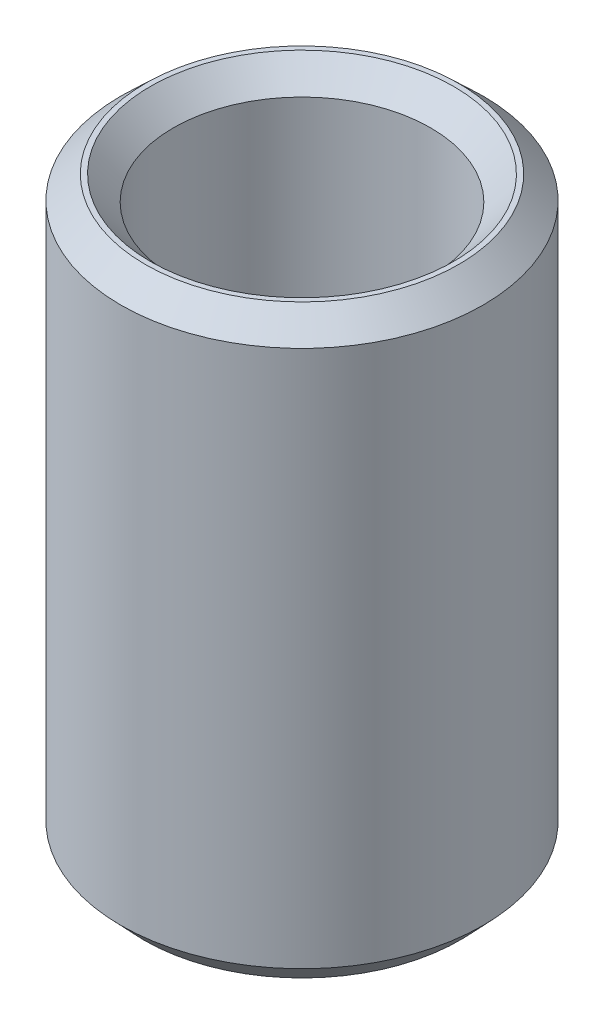
from build123d import *
from OCP.BRepFilletAPI import BRepFilletAPI_MakeChamfer

# Parameters (mm, degrees)
SKETCH1_R           = 15
BOSS_EXTRUDE1_DEPTH = 48.421484013
SKETCH2_R           = 10.652734929
CUT_EXTRUDE1_DEPTH  = 53.864355799
CHAMFER1_SIZE       = 1.909002523
CHAMFER1_SIZE2      = 2.013737742


with BuildPart() as part:
    # Sketch1 → Boss-Extrude1 (new body)
    with BuildSketch(Plane(origin=(0, 0, 0), x_dir=(1, 0, 0), z_dir=(0, 1, 0))):
        Circle(SKETCH1_R)
    extrude(amount=BOSS_EXTRUDE1_DEPTH)

    # Sketch2 → Cut-Extrude1 (cut, through all)
    with BuildSketch(Plane(origin=(0, 0, 0), x_dir=(1, 0, 0), z_dir=(0, 1, 0))):
        Circle(SKETCH2_R)
    extrude(amount=CUT_EXTRUDE1_DEPTH, mode=Mode.SUBTRACT)

    # Chamfer1: one chamfer whose edges measure the first distance from different faces: ONE call of the kernel's chamfer builder (chamfer() names one face for all edges)
    chamfer1_edges_1 = [part.edges().sort_by_distance(p)[0] for p in [
        (-10.652734929, 48.421484013, 0),
    ]]
    chamfer1_side_1 = [part.faces().sort_by_distance(p)[0] for p in [
        (-14.575735931, 48.421484013, 0),
    ]]
    chamfer1_edges_2 = [part.edges().sort_by_distance(p)[0] for p in [
        (-10.652734929, 0, 0),
    ]]
    chamfer1_side_2 = [part.faces().sort_by_distance(p)[0] for p in [
        (-10.652734929, 24.210742007, 0),
    ]]
    chamfer1_edges_3 = [part.edges().sort_by_distance(p)[0] for p in [
        (-15, 0, 0),
    ]]
    chamfer1_side_3 = [part.faces().sort_by_distance(p)[0] for p in [
        (-14.575735931, 0, 0),
    ]]
    chamfer1_edges_4 = [part.edges().sort_by_distance(p)[0] for p in [
        (-15, 48.421484013, 0),
    ]]
    chamfer1_side_4 = [part.faces().sort_by_distance(p)[0] for p in [
        (-15, 24.210742007, 0),
    ]]
    chamfer1 = BRepFilletAPI_MakeChamfer(part.part.solid().wrapped)
    for e in chamfer1_edges_1:
        chamfer1.Add(CHAMFER1_SIZE, CHAMFER1_SIZE2, e.wrapped, chamfer1_side_1[0].wrapped)  # the first distance lies on this face
    for e in chamfer1_edges_2:
        chamfer1.Add(CHAMFER1_SIZE, CHAMFER1_SIZE2, e.wrapped, chamfer1_side_2[0].wrapped)  # the first distance lies on this face
    for e in chamfer1_edges_3:
        chamfer1.Add(CHAMFER1_SIZE, CHAMFER1_SIZE2, e.wrapped, chamfer1_side_3[0].wrapped)  # the first distance lies on this face
    for e in chamfer1_edges_4:
        chamfer1.Add(CHAMFER1_SIZE, CHAMFER1_SIZE2, e.wrapped, chamfer1_side_4[0].wrapped)  # the first distance lies on this face
    add(Compound.cast(chamfer1.Shape()), mode=Mode.REPLACE)


solid = part.part
